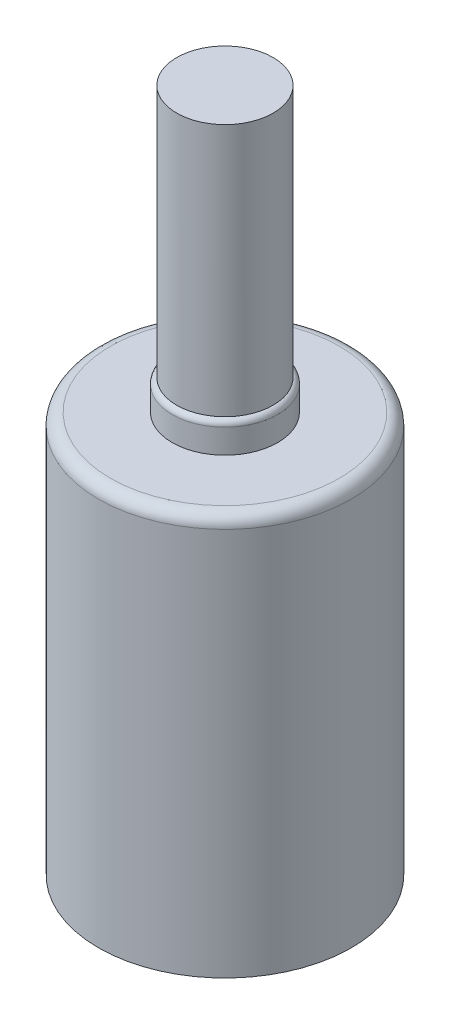
from build123d import *

# Parameters (mm, degrees)
SKETCH1_R           = 21
BOSS_EXTRUDE1_DEPTH = 66.5
SKETCH3_R           = 8.75
BOSS_EXTRUDE2_DEPTH = 5
FILLET1_R           = 2
SKETCH4_R           = 8
BOSS_EXTRUDE3_DEPTH = 42
SKETCH5_R           = 7.25
BOSS_EXTRUDE4_DEPTH = 5
FILLET2_R           = 1
SKETCH6_R           = 2.5
BOSS_EXTRUDE5_DEPTH = 7
FILLET3_R           = 0.5


with BuildPart() as part:
    # Sketch1 → Boss-Extrude1 (new body)
    with BuildSketch(Plane(origin=(0, 0, 0), x_dir=(1, 0, 0), z_dir=(0, 1, 0))):
        with Locations(Location((0, 0, 0), (0, 0, 270))):
            Circle(SKETCH1_R)
    extrude(amount=BOSS_EXTRUDE1_DEPTH)

    # Sketch3 → Boss-Extrude2 (add)
    with BuildSketch(Plane(origin=(0, 66.5, 0), x_dir=(1, 0, 0), z_dir=(0, 1, 0))):
        with Locations(Location((0, 0, 0), (0, 0, 270))):
            Circle(SKETCH3_R)
    extrude(amount=BOSS_EXTRUDE2_DEPTH)

    # Fillet1
    fillet1_edges = [part.edges().sort_by_distance(p)[0] for p in [
        (0, 66.5, -21),
    ]]
    fillet(fillet1_edges, radius=FILLET1_R)

    # Sketch4 → Boss-Extrude3 (add)
    with BuildSketch(Plane(origin=(0, 71.5, 0), x_dir=(1, 0, 0), z_dir=(0, 1, 0))):
        with Locations(Location((0, 0, 0), (0, 0, 90))):
            Circle(SKETCH4_R)
    extrude(amount=BOSS_EXTRUDE3_DEPTH)

    # Sketch5 → Boss-Extrude4 (add)
    with BuildSketch(Plane.XZ):
        with Locations(Location((0, 0, 0), (0, 0, 270))):
            Circle(SKETCH5_R)
    extrude(amount=BOSS_EXTRUDE4_DEPTH)

    # Fillet2
    # the kernel refuses this fillet: 1 mm, written as the material it takes off along each edge
    with BuildSketch(Plane(origin=(0, -5, 0), x_dir=(0, 0, -1), z_dir=(-1, 0, 0))) as fillet2_piece_1:
        with BuildLine():
            CenterArc((7.25 - FILLET2_R, -FILLET2_R), FILLET2_R, 0, 90)
            Line((7.25 - FILLET2_R, 0), (7.25 - FILLET2_R, FILLET2_R * 0.02))
            Line((7.25 - FILLET2_R, FILLET2_R * 0.02), (7.25 + FILLET2_R * 0.02, FILLET2_R * 0.02))
            Line((7.25 + FILLET2_R * 0.02, FILLET2_R * 0.02), (7.25 + FILLET2_R * 0.02, -FILLET2_R))
            Line((7.25 + FILLET2_R * 0.02, -FILLET2_R), (7.25, -FILLET2_R))
        make_face()
    revolve(axis=Axis((0, -5, 0), (0, -1, 0)), mode=Mode.SUBTRACT)
    with BuildSketch(Plane(origin=(0, 71.5, 0), x_dir=(0, 0, 1), z_dir=(-1, 0, 0))) as fillet2_piece_2:
        with BuildLine():
            CenterArc((7.75, -0.968245837), FILLET2_R, 0, 75.522487814)
            Line((8, 0), (8.005, 0.019364917))
            ThreePointArc((8.005, 0.019364917), (8.375, 0.02), (8.75, 0.02))
            Line((8.75, 0.02), (8.77, 0))
            Line((8.77, 0), (8.77, -0.968245837))
            Line((8.77, -0.968245837), (8.75, -0.968245837))
        make_face()
    revolve(axis=Axis((0, 71.5, 0), (0, 1, 0)), mode=Mode.SUBTRACT)

    # Sketch6 → Boss-Extrude5 (add)
    with BuildSketch(Plane.XZ.offset(5)):
        with Locations(Location((0, 0, 0), (0, 0, 270))):
            Circle(SKETCH6_R)
    extrude(amount=BOSS_EXTRUDE5_DEPTH)

    # Fillet3
    fillet3_edges = [part.edges().sort_by_distance(p)[0] for p in [
        (0, -12, 2.5),
    ]]
    fillet(fillet3_edges, radius=FILLET3_R)


solid = part.part
